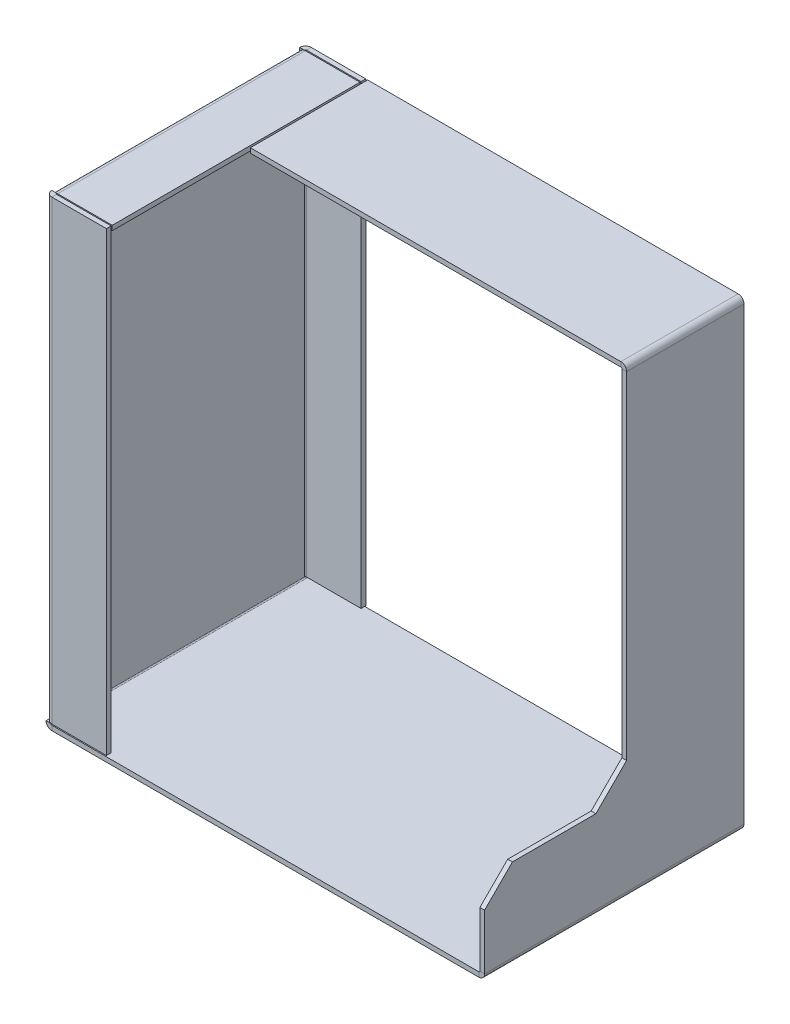
from build123d import *

# Parameters (mm, degrees)
SKETCH1_W                    = 295.275
SKETCH1_H                    = 174.625
BASE_FLANGE1_DEPTH           = 3.175
EDGE_FLANGE1_STRIP_W         = 14.1732
EDGE_FLANGE1_STRIP_H         = 3.175
EDGE_FLANGE1_STRIP_CUT_DEPTH = 174.625
EDGE_FLANGE1_DEPTH           = 174.625
EDGE_FLANGE2_STRIP_W         = 14.1732
EDGE_FLANGE2_STRIP_H         = 3.175
EDGE_FLANGE2_STRIP_CUT_DEPTH = 307.2384
EDGE_FLANGE2_DEPTH           = 307.2384
EDGE_FLANGE3_STRIP_W         = 14.1732
EDGE_FLANGE3_STRIP_H         = 3.175
EDGE_FLANGE3_STRIP_CUT_DEPTH = 307.2384
EDGE_FLANGE3_DEPTH           = 307.2384
EDGE_FLANGE4_STRIP_W         = 14.1732
EDGE_FLANGE4_STRIP_H         = 3.175
EDGE_FLANGE4_STRIP_CUT_DEPTH = 166.8018
EDGE_FLANGE4_DEPTH           = 166.8018
EDGE_FLANGE5_STRIP_W         = 14.1732
EDGE_FLANGE5_STRIP_H         = 3.175
EDGE_FLANGE5_STRIP_CUT_DEPTH = 174.625
EDGE_FLANGE5_DEPTH           = 174.625
CUT_EXTRUDE1_REACH           = 437.499
EDGE_FLANGE7_STRIP_W         = 14.1732
EDGE_FLANGE7_STRIP_H         = 3.175
EDGE_FLANGE7_STRIP_CUT_DEPTH = 78.994
EDGE_FLANGE7_DEPTH           = 78.994


# Sheet-metal steps are written as plain solids
with BuildPart() as part:
    # Sketch1 → Base-Flange1 (new body)
    with BuildSketch(Plane(origin=(0, 0, 0), x_dir=(1, 0, 0), z_dir=(0, 1, 0))):
        Rectangle(SKETCH1_W, SKETCH1_H)
    extrude(amount=-BASE_FLANGE1_DEPTH)

    # Edge-Flange1 strip (across the edge) → Edge-Flange1 strip cut (cut)
    with BuildSketch(Plane(origin=(-147.6375, 0, -87.3125), x_dir=(1, 0, 0), z_dir=(0, 0, 1))):
        with Locations((-3.175, -1.5875)):
            Rectangle(EDGE_FLANGE1_STRIP_W, EDGE_FLANGE1_STRIP_H)
    extrude(amount=EDGE_FLANGE1_STRIP_CUT_DEPTH, mode=Mode.SUBTRACT)

    # Edge-Flange1 section (across the edge) → Edge-Flange1 (add)
    with BuildSketch(Plane(origin=(-147.6375, 0, -87.3125), x_dir=(1, 0, 0), z_dir=(0, 0, 1))):
        with BuildLine():
            Line((0, 0.7366), (0, 307.975))
            Line((0, 307.975), (3.175, 307.975))
            Line((3.175, 307.975), (3.175, 0.7366))
            ThreePointArc((3.175, 0.7366), (3.390745145, 0.215745145), (3.9116, 0))
            Line((3.9116, 0), (3.9116, -3.175))
            ThreePointArc((3.9116, -3.175), (1.145681115, -2.029318885), (0, 0.7366))
        make_face()
    extrude(amount=EDGE_FLANGE1_DEPTH)

    # Edge-Flange2 strip (across the edge) → Edge-Flange2 strip cut (cut)
    with BuildSketch(Plane(origin=(-144.4625, 307.975, 87.3125), x_dir=(0, 0, -1), z_dir=(0, -1, 0))):
        with Locations((-3.175, -1.5875)):
            Rectangle(EDGE_FLANGE2_STRIP_W, EDGE_FLANGE2_STRIP_H)
    extrude(amount=EDGE_FLANGE2_STRIP_CUT_DEPTH, mode=Mode.SUBTRACT)

    # Edge-Flange2 section (across the edge) → Edge-Flange2 (add)
    with BuildSketch(Plane(origin=(-144.4625, 307.975, 87.3125), x_dir=(0, 0, -1), z_dir=(0, -1, 0))):
        with BuildLine():
            Line((0, 0.7366), (0, 37.465))
            Line((0, 37.465), (3.175, 37.465))
            Line((3.175, 37.465), (3.175, 0.7366))
            ThreePointArc((3.175, 0.7366), (3.390745145, 0.215745145), (3.9116, 0))
            Line((3.9116, 0), (3.9116, -3.175))
            ThreePointArc((3.9116, -3.175), (1.145681115, -2.029318885), (0, 0.7366))
        make_face()
    extrude(amount=EDGE_FLANGE2_DEPTH)

    # Edge-Flange3 strip (across the edge) → Edge-Flange3 strip cut (cut)
    with BuildSketch(Plane(origin=(-144.4625, 0.7366, -87.3125), x_dir=(0, 0, 1), z_dir=(0, 1, 0))):
        with Locations((-3.175, -1.5875)):
            Rectangle(EDGE_FLANGE3_STRIP_W, EDGE_FLANGE3_STRIP_H)
    extrude(amount=EDGE_FLANGE3_STRIP_CUT_DEPTH, mode=Mode.SUBTRACT)

    # Edge-Flange3 section (across the edge) → Edge-Flange3 (add)
    with BuildSketch(Plane(origin=(-144.4625, 0.7366, -87.3125), x_dir=(0, 0, 1), z_dir=(0, 1, 0))):
        with BuildLine():
            Line((0, 0.7366), (0, 37.465))
            Line((0, 37.465), (3.175, 37.465))
            Line((3.175, 37.465), (3.175, 0.7366))
            ThreePointArc((3.175, 0.7366), (3.390745145, 0.215745145), (3.9116, 0))
            Line((3.9116, 0), (3.9116, -3.175))
            ThreePointArc((3.9116, -3.175), (1.145681115, -2.029318885), (0, 0.7366))
        make_face()
    extrude(amount=EDGE_FLANGE3_DEPTH)

    # Edge-Flange4 strip (across the edge) → Edge-Flange4 strip cut (cut)
    with BuildSketch(Plane(origin=(-144.4625, 307.975, -83.4009), x_dir=(0, -1, 0), z_dir=(0, 0, 1))):
        with Locations((-3.175, -1.5875)):
            Rectangle(EDGE_FLANGE4_STRIP_W, EDGE_FLANGE4_STRIP_H)
    extrude(amount=EDGE_FLANGE4_STRIP_CUT_DEPTH, mode=Mode.SUBTRACT)

    # Edge-Flange4 section (across the edge) → Edge-Flange4 (add)
    with BuildSketch(Plane(origin=(-144.4625, 307.975, -83.4009), x_dir=(0, -1, 0), z_dir=(0, 0, 1))):
        with BuildLine():
            Line((0, 0.7366), (0, 37.465))
            Line((0, 37.465), (3.175, 37.465))
            Line((3.175, 37.465), (3.175, 0.7366))
            ThreePointArc((3.175, 0.7366), (3.390745145, 0.215745145), (3.9116, 0))
            Line((3.9116, 0), (3.9116, -3.175))
            ThreePointArc((3.9116, -3.175), (1.145681115, -2.029318885), (0, 0.7366))
        make_face()
    extrude(amount=EDGE_FLANGE4_DEPTH)

    # Edge-Flange5 strip (across the edge) → Edge-Flange5 strip cut (cut)
    with BuildSketch(Plane(origin=(147.6375, 0, 87.3125), x_dir=(-1, 0, 0), z_dir=(0, 0, -1))):
        with Locations((-3.175, -1.5875)):
            Rectangle(EDGE_FLANGE5_STRIP_W, EDGE_FLANGE5_STRIP_H)
    extrude(amount=EDGE_FLANGE5_STRIP_CUT_DEPTH, mode=Mode.SUBTRACT)

    # Edge-Flange5 section (across the edge) → Edge-Flange5 (add)
    with BuildSketch(Plane(origin=(147.6375, 0, 87.3125), x_dir=(-1, 0, 0), z_dir=(0, 0, -1))):
        with BuildLine():
            Line((0, 0.7366), (0, 307.975))
            Line((0, 307.975), (3.175, 307.975))
            Line((3.175, 307.975), (3.175, 0.7366))
            ThreePointArc((3.175, 0.7366), (3.390745145, 0.215745145), (3.9116, 0))
            Line((3.9116, 0), (3.9116, -3.175))
            ThreePointArc((3.9116, -3.175), (1.145681115, -2.029318885), (0, 0.7366))
        make_face()
    extrude(amount=EDGE_FLANGE5_DEPTH)

    # Sketch29 → Cut-Extrude1 (cut, up to next)
    with BuildSketch(Plane(origin=(147.6375, 0, 0), x_dir=(0, 0, -1), z_dir=(1, 0, 0)), mode=Mode.PRIVATE) as cut_extrude1_sk1:
        Polygon((-87.3125, 37.8968), (-68.5673, 56.642), (-12.3825, 56.642), (8.3185, 77.343), (8.3185, 307.975), (-87.3125, 307.975), align=None)
    cut_extrude1_tool1 = extrude(cut_extrude1_sk1.sketch, amount=-CUT_EXTRUDE1_REACH, mode=Mode.PRIVATE) & part.part
    add(cut_extrude1_tool1.solids().sort_by_distance((147.6375, 182.403147, 40.166664))[0], mode=Mode.SUBTRACT)

    # Edge-Flange7 strip (across the edge) → Edge-Flange7 strip cut (cut)
    with BuildSketch(Plane(origin=(144.4625, 307.975, -8.3185), x_dir=(0, -1, 0), z_dir=(0, 0, -1))):
        with Locations((-3.175, -1.5875)):
            Rectangle(EDGE_FLANGE7_STRIP_W, EDGE_FLANGE7_STRIP_H)
    extrude(amount=EDGE_FLANGE7_STRIP_CUT_DEPTH, mode=Mode.SUBTRACT)

    # Edge-Flange7 section (across the edge) → Edge-Flange7 (add)
    with BuildSketch(Plane(origin=(144.4625, 307.975, -8.3185), x_dir=(0, -1, 0), z_dir=(0, 0, -1))):
        with BuildLine():
            Line((0, 0.7366), (0, 250.19))
            Line((0, 250.19), (3.175, 250.19))
            Line((3.175, 250.19), (3.175, 0.7366))
            ThreePointArc((3.175, 0.7366), (3.390745145, 0.215745145), (3.9116, 0))
            Line((3.9116, 0), (3.9116, -3.175))
            ThreePointArc((3.9116, -3.175), (1.145681115, -2.029318885), (0, 0.7366))
        make_face()
    extrude(amount=EDGE_FLANGE7_DEPTH)


solid = part.part
